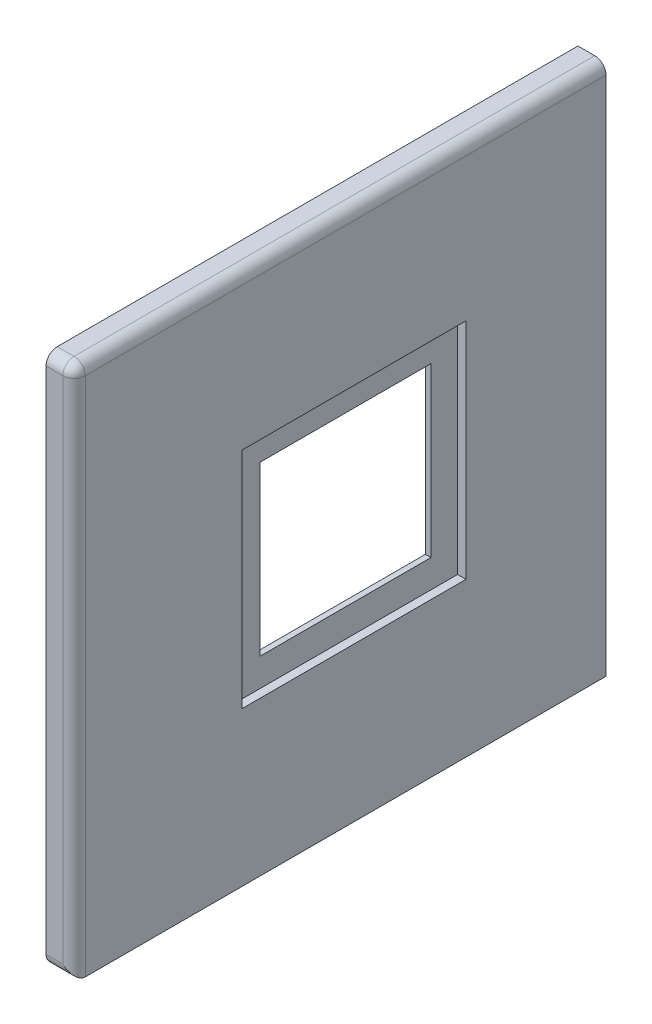
from build123d import *

# Parameters (mm, degrees)
SKETCH1_W           = 190
SKETCH1_H           = 190
BOSS_EXTRUDE1_DEPTH = 10
CUT_EXTRUDE1_DEPTH  = 5
SKETCH3_W           = 61.021512422
SKETCH3_H           = 60
CUT_EXTRUDE2_DEPTH  = 139.021737418
SKETCH4_W           = 80
SKETCH4_H           = 80
CUT_EXTRUDE3_DEPTH  = 3
FILLET1_R           = 4
SHELL1_START        = -90
SHELL1_DEPTH        = 180
SHELL1_2_DEPTH      = 45
SHELL1_START_2      = 45
SHELL1_3_DEPTH      = 45


# Read off the part's stored shape, not the designer's step: Shell1
with BuildPart() as part:
    # Sketch1 → Boss-Extrude1 (new body)
    with BuildSketch(Plane(origin=(0, 0, 0), x_dir=(0, 0, -1), z_dir=(1, 0, 0))):
        with Locations((-5, 0)):
            Rectangle(SKETCH1_W, SKETCH1_H)
    extrude(amount=BOSS_EXTRUDE1_DEPTH)

    # Sketch2 → Cut-Extrude1 (cut)
    with BuildSketch(Plane.ZY):
        Polygon((36.5, -36.5), (36.5, 36.5), (25.709845909, 36.5), (5.209845909, 45.5), (-5.209845909, 45.5), (-25.709845909, 36.5), (-36.5, 36.5), (-36.5, -36.5), align=None)
    extrude(amount=-CUT_EXTRUDE1_DEPTH, mode=Mode.SUBTRACT)

    # Sketch3 → Cut-Extrude2 (cut, through all)
    with BuildSketch(Plane.ZY.offset(-5)):
        Rectangle(SKETCH3_W, SKETCH3_H)
    extrude(amount=-CUT_EXTRUDE2_DEPTH, mode=Mode.SUBTRACT)

    # Sketch4 → Cut-Extrude3 (cut)
    with BuildSketch(Plane(origin=(10, 0, 0), x_dir=(0, 0, -1), z_dir=(1, 0, 0))):
        Rectangle(SKETCH4_W, SKETCH4_H)
    extrude(amount=-CUT_EXTRUDE3_DEPTH, mode=Mode.SUBTRACT)

    # Fillet1
    fillet1_edges = [part.edges().sort_by_distance(p)[0] for p in [
        (10, 95, 5),
        (10, 0, 100),
        (5, 95, 100),
        (5, -95, 100),
    ]]
    fillet(fillet1_edges, radius=FILLET1_R)

    # Shell1 outline → Shell1 (cut)
    with BuildSketch(Plane(origin=(0, 0, 0), x_dir=(1, 0, 0), z_dir=(0, 1, 0)).offset(SHELL1_START)):
        Polygon((7, -45), (2, -45), (2, 45), (7, 45), (7, 85), (0, 85), (0, -95), (7, -95), align=None)
    extrude(amount=SHELL1_DEPTH, mode=Mode.SUBTRACT)

    # Shell1 2 outline → Shell1 2 (cut)
    with BuildSketch(Plane(origin=(0, 0, 0), x_dir=(1, 0, 0), z_dir=(0, 1, 0)).offset(SHELL1_START)):
        Polygon((2, -36.5), (2, -45), (7, -45), (7, 45), (2, 45), (2, 36.5), align=None)
    extrude(amount=SHELL1_2_DEPTH, mode=Mode.SUBTRACT)

    # Shell1 3 outline → Shell1 3 (cut)
    with BuildSketch(Plane(origin=(0, 0, 0), x_dir=(1, 0, 0), z_dir=(0, 1, 0)).offset(SHELL1_START_2)):
        Polygon((2, -36.5), (2, -45), (7, -45), (7, 45), (2, 45), (2, 36.5), align=None)
    extrude(amount=SHELL1_3_DEPTH, mode=Mode.SUBTRACT)


solid = part.part
